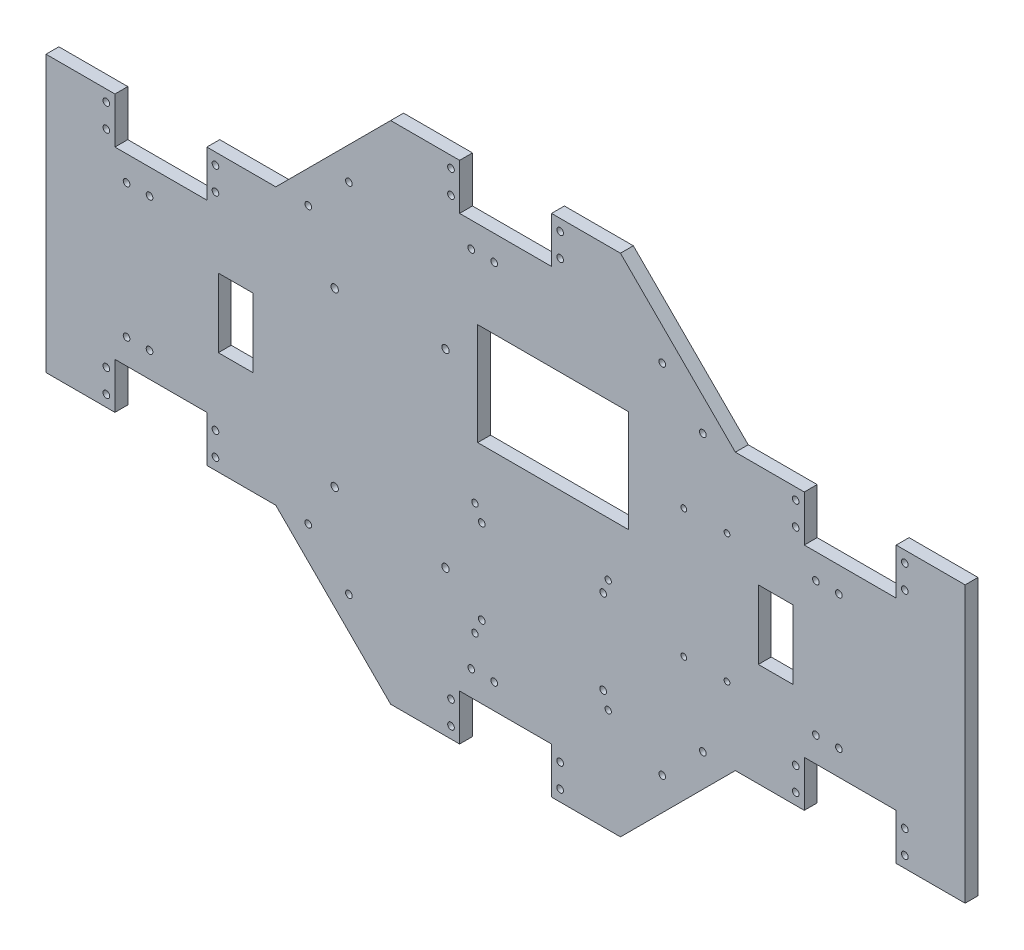
from build123d import *

# Parameters (mm, degrees)
BOSS_EXTRU_1_DEPTH       = 5.6
ENL_V_MAT_EXTRU_1_REACH  = 416.887
ESQUISSE2_W              = 40
ESQUISSE2_H              = 20
ENL_V_MAT_EXTRU_2_REACH  = 416.887
ESQUISSE3_R              = 1.45
SKETCH2_W                = 40
SKETCH2_H                = 20
CUT_EXTRUDE2_DEPTH       = 415.887165384
SKETCH5_R                = 1.45
CUT_EXTRUDE4_DEPTH       = 415.887165384
ESQUISSE4_R              = 1.375
ENL_V_MAT_EXTRU_4_DEPTH  = 415.887165384
ESQUISSE6_R              = 1.45
ENL_V_MAT_EXTRU_6_DEPTH  = 415.887165384
ESQUISSE8_R              = 1.25
ENL_V_MAT_EXTRU_7_DEPTH  = 415.887165384
ESQUISSE9_R              = 1.6
ENL_V_MAT_EXTRU_8_DEPTH  = 415.887165384
ESQUISSE10_W             = 65.69
ESQUISSE10_H             = 44.45
ENL_V_MAT_EXTRU_9_DEPTH  = 415.887165384
ESQUISSE11_W             = 15
ESQUISSE11_H             = 30
ENL_V_MAT_EXTRU_10_DEPTH = 415.887165384
ESQUISSE12_R             = 1.45
ENL_V_MAT_EXTRU_11_DEPTH = 415.887165384


with BuildPart() as part:
    # Esquisse1 → Boss.-Extru.1 (new body)
    with BuildSketch(Plane.XY):
        Polygon((100, -60), (150, -110), (250, -110), (300, -60), (400, -60), (400, 0), (25.838605695, 0), (0, 0), (0, -60), align=None)
    boss_extru_1 = extrude(amount=BOSS_EXTRU_1_DEPTH)

    # Esquisse2 → Enlèv. mat.-Extru.1 (cut, up to next)
    with BuildSketch(Plane.XY.offset(5.6), mode=Mode.PRIVATE) as enl_v_mat_extru_1_sk1:
        with Locations((50, -50)):
            Rectangle(ESQUISSE2_W, ESQUISSE2_H)
    enl_v_mat_extru_1_tool1 = extrude(enl_v_mat_extru_1_sk1.sketch, amount=-ENL_V_MAT_EXTRU_1_REACH, mode=Mode.PRIVATE) & part.part
    enl_v_mat_extru_1 = enl_v_mat_extru_1_tool1.solids().sort_by_distance((50, -50, 5.6))[0]
    add(enl_v_mat_extru_1, mode=Mode.SUBTRACT)

    # Esquisse3 → Enlèv. mat.-Extru.2 (cut, up to next)
    with BuildSketch(Plane.XY.offset(5.6), mode=Mode.PRIVATE) as enl_v_mat_extru_2_sk1:
        with Locations((26.25, -55.08)):
            Circle(ESQUISSE3_R)
    enl_v_mat_extru_2_tool1 = extrude(enl_v_mat_extru_2_sk1.sketch, amount=-ENL_V_MAT_EXTRU_2_REACH, mode=Mode.PRIVATE) & part.part
    # Esquisse3 → Enlèv. mat.-Extru.2 (cut, up to next)
    with BuildSketch(Plane.XY.offset(5.6), mode=Mode.PRIVATE) as enl_v_mat_extru_2_sk2:
        with Locations((73.75, -55.08)):
            Circle(ESQUISSE3_R)
    enl_v_mat_extru_2_tool2 = extrude(enl_v_mat_extru_2_sk2.sketch, amount=-ENL_V_MAT_EXTRU_2_REACH, mode=Mode.PRIVATE) & part.part
    # Esquisse3 → Enlèv. mat.-Extru.2 (cut, up to next)
    with BuildSketch(Plane.XY.offset(5.6), mode=Mode.PRIVATE) as enl_v_mat_extru_2_sk3:
        with Locations((73.75, -44.92)):
            Circle(ESQUISSE3_R)
    enl_v_mat_extru_2_tool3 = extrude(enl_v_mat_extru_2_sk3.sketch, amount=-ENL_V_MAT_EXTRU_2_REACH, mode=Mode.PRIVATE) & part.part
    # Esquisse3 → Enlèv. mat.-Extru.2 (cut, up to next)
    with BuildSketch(Plane.XY.offset(5.6), mode=Mode.PRIVATE) as enl_v_mat_extru_2_sk4:
        with Locations((26.25, -44.92)):
            Circle(ESQUISSE3_R)
    enl_v_mat_extru_2_tool4 = extrude(enl_v_mat_extru_2_sk4.sketch, amount=-ENL_V_MAT_EXTRU_2_REACH, mode=Mode.PRIVATE) & part.part
    # Esquisse3 → Enlèv. mat.-Extru.2 (cut, up to next)
    with BuildSketch(Plane.XY.offset(5.6), mode=Mode.PRIVATE) as enl_v_mat_extru_2_sk5:
        with Locations((35.06, -29.09)):
            Circle(ESQUISSE3_R)
    enl_v_mat_extru_2_tool5 = extrude(enl_v_mat_extru_2_sk5.sketch, amount=-ENL_V_MAT_EXTRU_2_REACH, mode=Mode.PRIVATE) & part.part
    # Esquisse3 → Enlèv. mat.-Extru.2 (cut, up to next)
    with BuildSketch(Plane.XY.offset(5.6), mode=Mode.PRIVATE) as enl_v_mat_extru_2_sk6:
        with Locations((45.06, -29.09)):
            Circle(ESQUISSE3_R)
    enl_v_mat_extru_2_tool6 = extrude(enl_v_mat_extru_2_sk6.sketch, amount=-ENL_V_MAT_EXTRU_2_REACH, mode=Mode.PRIVATE) & part.part
    enl_v_mat_extru_2_1 = enl_v_mat_extru_2_tool1.solids().sort_by_distance((26.25, -55.08, 5.6))[0]
    add(enl_v_mat_extru_2_1, mode=Mode.SUBTRACT)
    enl_v_mat_extru_2_2 = enl_v_mat_extru_2_tool2.solids().sort_by_distance((73.75, -55.08, 5.6))[0]
    add(enl_v_mat_extru_2_2, mode=Mode.SUBTRACT)
    enl_v_mat_extru_2_3 = enl_v_mat_extru_2_tool3.solids().sort_by_distance((73.75, -44.92, 5.6))[0]
    add(enl_v_mat_extru_2_3, mode=Mode.SUBTRACT)
    enl_v_mat_extru_2_4 = enl_v_mat_extru_2_tool4.solids().sort_by_distance((26.25, -44.92, 5.6))[0]
    add(enl_v_mat_extru_2_4, mode=Mode.SUBTRACT)
    enl_v_mat_extru_2_5 = enl_v_mat_extru_2_tool5.solids().sort_by_distance((35.06, -29.09, 5.6))[0]
    add(enl_v_mat_extru_2_5, mode=Mode.SUBTRACT)
    enl_v_mat_extru_2_6 = enl_v_mat_extru_2_tool6.solids().sort_by_distance((45.06, -29.09, 5.6))[0]
    add(enl_v_mat_extru_2_6, mode=Mode.SUBTRACT)
    enl_v_mat_extru_2 = enl_v_mat_extru_2_1 + enl_v_mat_extru_2_2 + enl_v_mat_extru_2_3 + enl_v_mat_extru_2_4 + enl_v_mat_extru_2_5 + enl_v_mat_extru_2_6  # Enlèv. mat.-Extru.2 as one shape, for the pattern or mirror that repeats it

    # Sketch2 → Cut-Extrude2 (cut, symmetric)
    with BuildSketch(Plane.XY):
        with Locations((350, -50)):
            Rectangle(SKETCH2_W, SKETCH2_H)
        with Locations((200, -100)):
            Rectangle(SKETCH2_W, SKETCH2_H)
    cut_extrude2 = extrude(amount=CUT_EXTRUDE2_DEPTH, both=True, mode=Mode.SUBTRACT)

    # Sketch5 → Cut-Extrude4 (cut, through all)
    with BuildSketch(Plane.XY):
        with Locations((176.25, -105.08)):
            Circle(SKETCH5_R)
        with Locations((223.75, -105.08)):
            Circle(SKETCH5_R)
        with Locations((223.75, -94.92)):
            Circle(SKETCH5_R)
        with Locations((176.25, -94.92)):
            Circle(SKETCH5_R)
        with Locations((326.25, -55.08)):
            Circle(SKETCH5_R)
        with Locations((373.75, -55.08)):
            Circle(SKETCH5_R)
        with Locations((373.75, -44.92)):
            Circle(SKETCH5_R)
        with Locations((326.25, -44.92)):
            Circle(SKETCH5_R)
        with Locations((185.06, -79.09)):
            Circle(SKETCH5_R)
        with Locations((195.06, -79.09)):
            Circle(SKETCH5_R)
        with Locations((335.06, -29.09)):
            Circle(SKETCH5_R)
        with Locations((345.06, -29.09)):
            Circle(SKETCH5_R)
    cut_extrude4 = extrude(amount=CUT_EXTRUDE4_DEPTH, mode=Mode.SUBTRACT)

    # Mirror1: Boss.-Extru.1, Enlèv. mat.-Extru.1, Enlèv. mat.-Extru.2, Cut-Extrude2, Cut-Extrude4 across plane
    add(boss_extru_1.mirror(Plane.ZX))
    add(enl_v_mat_extru_1.mirror(Plane.ZX), mode=Mode.SUBTRACT)
    add(enl_v_mat_extru_2.mirror(Plane.ZX), mode=Mode.SUBTRACT)
    add(cut_extrude2.mirror(Plane.ZX), mode=Mode.SUBTRACT)
    add(cut_extrude4.mirror(Plane.ZX), mode=Mode.SUBTRACT)

    # Esquisse4 → Enlèv. mat.-Extru.4 (cut, through all)
    with BuildSketch(Plane.XY.offset(5.6)):
        with Locations((244.664176733, -15.881959587)):
            Circle(ESQUISSE4_R)
        with Locations((186.664176733, -15.881959587)):
            Circle(ESQUISSE4_R)
        with Locations((186.664176733, -64.881959587)):
            Circle(ESQUISSE4_R)
        with Locations((244.664176733, -64.881959587)):
            Circle(ESQUISSE4_R)
    extrude(amount=-ENL_V_MAT_EXTRU_4_DEPTH, mode=Mode.SUBTRACT)

    # Esquisse6 → Enlèv. mat.-Extru.6 (cut, through all)
    with BuildSketch(Plane(origin=(0, 0, 0), x_dir=(-1, 0, 0), z_dir=(0, 0, -1))):
        with Locations((-242.477514226, -21.821254876)):
            Circle(ESQUISSE6_R)
        with Locations((-189.647514226, -21.821254876)):
            Circle(ESQUISSE6_R)
        with Locations((-189.647514226, -58.451254876)):
            Circle(ESQUISSE6_R)
        with Locations((-242.477514226, -58.451254876)):
            Circle(ESQUISSE6_R)
    extrude(amount=-ENL_V_MAT_EXTRU_6_DEPTH, mode=Mode.SUBTRACT)

    # Esquisse8 → Enlèv. mat.-Extru.7 (cut, through all)
    with BuildSketch(Plane(origin=(0, 0, 0), x_dir=(-1, 0, 0), z_dir=(0, 0, -1))):
        with Locations((-277.569790732, 27.639309874)):
            Circle(ESQUISSE8_R)
        with Locations((-296.369790732, 27.639309874)):
            Circle(ESQUISSE8_R)
        with Locations((-296.369790732, -28.260690126)):
            Circle(ESQUISSE8_R)
        with Locations((-277.569790732, -28.260690126)):
            Circle(ESQUISSE8_R)
    extrude(amount=-ENL_V_MAT_EXTRU_7_DEPTH, mode=Mode.SUBTRACT)

    # Esquisse9 → Enlèv. mat.-Extru.8 (cut, through all)
    with BuildSketch(Plane(origin=(0, 0, 0), x_dir=(-1, 0, 0), z_dir=(0, 0, -1))):
        with Locations((-173.859034615, -46.655229164)):
            Circle(ESQUISSE9_R)
        with Locations((-125.639034615, -40.295229164)):
            Circle(ESQUISSE9_R)
        with Locations((-125.639034615, 34.584770836)):
            Circle(ESQUISSE9_R)
        with Locations((-173.859034615, 35.814770836)):
            Circle(ESQUISSE9_R)
    extrude(amount=-ENL_V_MAT_EXTRU_8_DEPTH, mode=Mode.SUBTRACT)

    # Esquisse10 → Enlèv. mat.-Extru.9 (cut, through all)
    with BuildSketch(Plane(origin=(0, 0, 0), x_dir=(-1, 0, 0), z_dir=(0, 0, -1))):
        with Locations((-220.713212963, 29.778229591)):
            Rectangle(ESQUISSE10_W, ESQUISSE10_H)
    extrude(amount=-ENL_V_MAT_EXTRU_9_DEPTH, mode=Mode.SUBTRACT)

    # Esquisse11 → Enlèv. mat.-Extru.10 (cut, through all)
    with BuildSketch(Plane(origin=(0, 0, 0), x_dir=(-1, 0, 0), z_dir=(0, 0, -1))):
        with Locations((-317.5, 0)):
            Rectangle(ESQUISSE11_W, ESQUISSE11_H)
        with Locations((-82.5, 0)):
            Rectangle(ESQUISSE11_W, ESQUISSE11_H)
    extrude(amount=-ENL_V_MAT_EXTRU_10_DEPTH, mode=Mode.SUBTRACT)

    # Esquisse12 → Enlèv. mat.-Extru.11 (cut, through all)
    with BuildSketch(Plane.XY.offset(5.6)):
        with Locations((131.819805153, 77.67766953)):
            Circle(ESQUISSE12_R)
        with Locations((114.142135624, 60)):
            Circle(ESQUISSE12_R)
        with Locations((285.857864376, 60)):
            Circle(ESQUISSE12_R)
        with Locations((268.180194847, 77.67766953)):
            Circle(ESQUISSE12_R)
        with Locations((285.857864376, -60)):
            Circle(ESQUISSE12_R)
        with Locations((268.180194847, -77.67766953)):
            Circle(ESQUISSE12_R)
        with Locations((131.819805153, -77.67766953)):
            Circle(ESQUISSE12_R)
        with Locations((114.142135624, -60)):
            Circle(ESQUISSE12_R)
    extrude(amount=-ENL_V_MAT_EXTRU_11_DEPTH, mode=Mode.SUBTRACT)


solid = part.part
